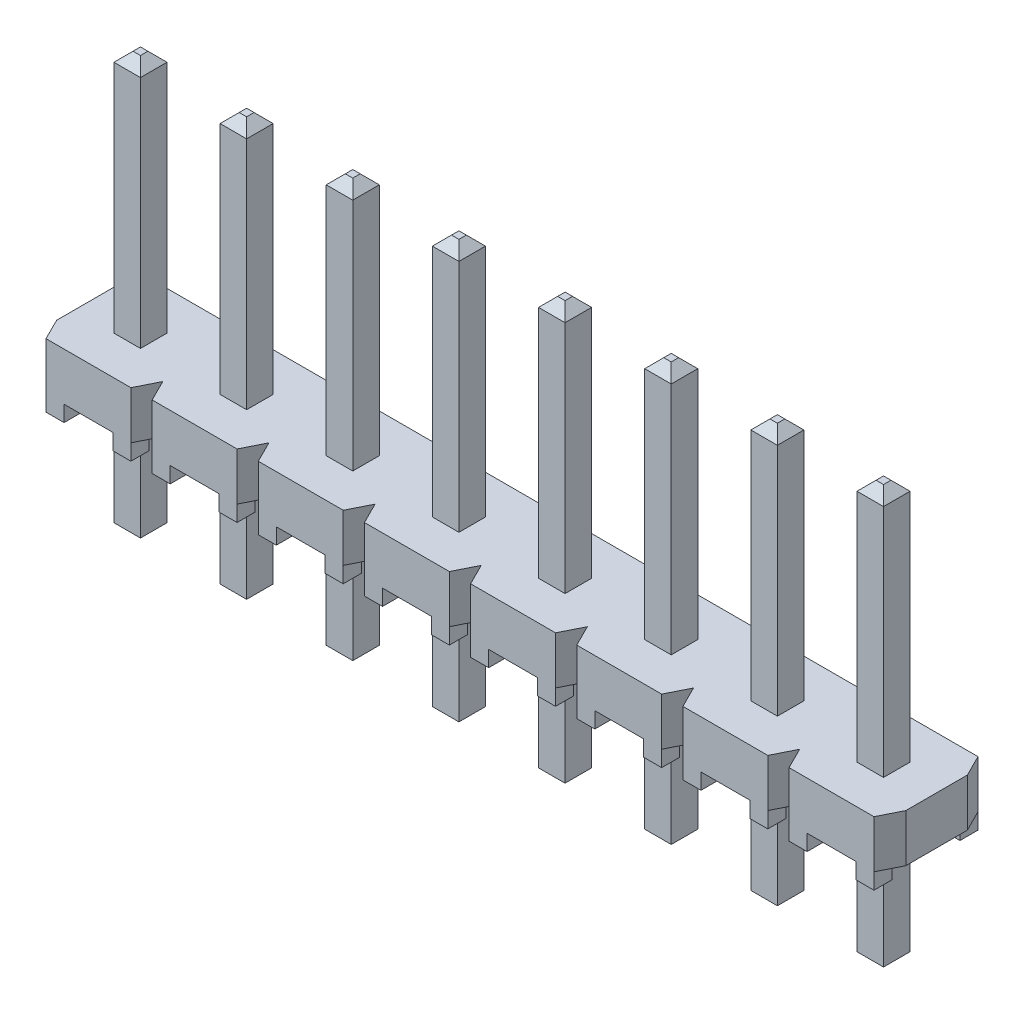
from build123d import *

# Parameters (mm, degrees)
SKETCH1_W                        = 20.32
SKETCH1_H                        = 2.4892
BASE_EXTRUDE_DEPTH               = 0.5715
SNAP_GROOVES_DEPTH               = 11.299566892
SKETCH4_W                        = 0.4318
SKETCH4_H                        = 0.4318
STANDOFFS_DEPTH                  = 0.381
POSITION_PATTERN_COUNT           = 8
POSITION_PATTERN_PITCH           = 2.54
SKETCH5_W                        = 0.635
SKETCH5_H                        = 10
TERMINAL_TH_DEPTH                = 0.3175
T1_TIP1_SIZE                     = 0.2286
TERMINAL_PATTERN_COUNT           = 8
TERMINAL_PATTERN_PITCH           = 2.54
T1_TIP1_OF_TERMINAL_PATTERN_SIZE = 0.2286


with BuildPart() as part:
    # Sketch1 → Base-Extrude (new, symmetric)
    with BuildSketch(Plane(origin=(0, 0, 0), x_dir=(1, 0, 0), z_dir=(0, 1, 0))):
        Rectangle(SKETCH1_W, SKETCH1_H)
    extrude(amount=BASE_EXTRUDE_DEPTH, both=True)

    # Sketch3 → Snap Grooves (cut, through all)
    with BuildSketch(Plane(origin=(0, 0.5715, 0), x_dir=(-1, 0, 0), z_dir=(0, 1, 0))):
        Polygon((7.366, 1.2446), (7.874, 1.2446), (7.62, 0.7366), align=None)
        Polygon((7.366, -1.2446), (7.874, -1.2446), (7.62, -0.7366), align=None)
        Polygon((10.16, -0.7366), (10.414, -1.2446), (9.906, -1.2446), align=None)
        Polygon((10.16, 0.7366), (10.414, 1.2446), (9.906, 1.2446), align=None)
    snap_grooves = extrude(amount=-SNAP_GROOVES_DEPTH, mode=Mode.SUBTRACT)

    # Sketch4 → Standoffs (add)
    with BuildSketch(Plane.XZ.offset(0.5715)):
        with Locations((-9.6901, 1.0287)):
            Rectangle(SKETCH4_W, SKETCH4_H)
        with Locations((-8.0899, 1.0287)):
            Rectangle(SKETCH4_W, SKETCH4_H)
        with Locations((-8.0899, -1.0287)):
            Rectangle(SKETCH4_W, SKETCH4_H)
        with Locations((-9.6901, -1.0287)):
            Rectangle(SKETCH4_W, SKETCH4_H)
    standoffs = extrude(amount=STANDOFFS_DEPTH)

    # Position Pattern: Snap Grooves, Standoffs ×8
    with Locations(*[(i * POSITION_PATTERN_PITCH, 0, 0) for i in range(1, POSITION_PATTERN_COUNT)]):
        add(snap_grooves, mode=Mode.SUBTRACT)
        add(standoffs)

    # Sketch5 → Terminal -TH (add, symmetric)
    with BuildSketch(Plane.ZY.offset(8.89)):
        with Locations((0, 1.4135)):
            Rectangle(SKETCH5_W, SKETCH5_H)
    terminal_th = extrude(amount=TERMINAL_TH_DEPTH, both=True)

    # T1 Tip1
    t1_tip1_edges = [part.edges().sort_by_distance(p)[0] for p in [
        (-8.5725, 6.4135, 0),
        (-8.89, 6.4135, -0.3175),
        (-9.2075, 6.4135, 0),
        (-8.89, 6.4135, 0.3175),
        (-8.89, -3.5865, -0.3175),
        (-9.2075, -3.5865, 0),
        (-8.89, -3.5865, 0.3175),
        (-8.5725, -3.5865, 0),
    ]]
    chamfer(t1_tip1_edges, length=T1_TIP1_SIZE)

    # Terminal Pattern: Terminal -TH ×8
    with Locations(*[(i * TERMINAL_PATTERN_PITCH, 0, 0) for i in range(1, TERMINAL_PATTERN_COUNT)]):
        add(terminal_th)

    # T1 Tip1 of Terminal Pattern
    t1_tip1_of_terminal_pattern_edges = [part.edges().sort_by_distance(p)[0] for p in [
        (-6.0325, 6.4135, 0),
        (-6.35, 6.4135, -0.3175),
        (-6.6675, 6.4135, 0),
        (-6.35, 6.4135, 0.3175),
        (-6.35, -3.5865, -0.3175),
        (-6.6675, -3.5865, 0),
        (-6.35, -3.5865, 0.3175),
        (-6.0325, -3.5865, 0),
        (-3.4925, 6.4135, 0),
        (-3.81, 6.4135, -0.3175),
        (-4.1275, 6.4135, 0),
        (-3.81, 6.4135, 0.3175),
        (-3.81, -3.5865, -0.3175),
        (-4.1275, -3.5865, 0),
        (-3.81, -3.5865, 0.3175),
        (-3.4925, -3.5865, 0),
        (-0.9525, 6.4135, 0),
        (-1.27, 6.4135, -0.3175),
        (-1.5875, 6.4135, 0),
        (-1.27, 6.4135, 0.3175),
        (-1.27, -3.5865, -0.3175),
        (-1.5875, -3.5865, 0),
        (-1.27, -3.5865, 0.3175),
        (-0.9525, -3.5865, 0),
        (1.5875, 6.4135, 0),
        (1.27, 6.4135, -0.3175),
        (0.9525, 6.4135, 0),
        (1.27, 6.4135, 0.3175),
        (1.27, -3.5865, -0.3175),
        (0.9525, -3.5865, 0),
        (1.27, -3.5865, 0.3175),
        (1.5875, -3.5865, 0),
        (4.1275, 6.4135, 0),
        (3.81, 6.4135, -0.3175),
        (3.4925, 6.4135, 0),
        (3.81, 6.4135, 0.3175),
        (3.81, -3.5865, -0.3175),
        (3.4925, -3.5865, 0),
        (3.81, -3.5865, 0.3175),
        (4.1275, -3.5865, 0),
        (6.6675, 6.4135, 0),
        (6.35, 6.4135, -0.3175),
        (6.0325, 6.4135, 0),
        (6.35, 6.4135, 0.3175),
        (6.35, -3.5865, -0.3175),
        (6.0325, -3.5865, 0),
        (6.35, -3.5865, 0.3175),
        (6.6675, -3.5865, 0),
        (9.2075, 6.4135, 0),
        (8.89, 6.4135, -0.3175),
        (8.5725, 6.4135, 0),
        (8.89, 6.4135, 0.3175),
        (8.89, -3.5865, -0.3175),
        (8.5725, -3.5865, 0),
        (8.89, -3.5865, 0.3175),
        (9.2075, -3.5865, 0),
    ]]
    chamfer(t1_tip1_of_terminal_pattern_edges, length=T1_TIP1_OF_TERMINAL_PATTERN_SIZE)


solid = part.part
